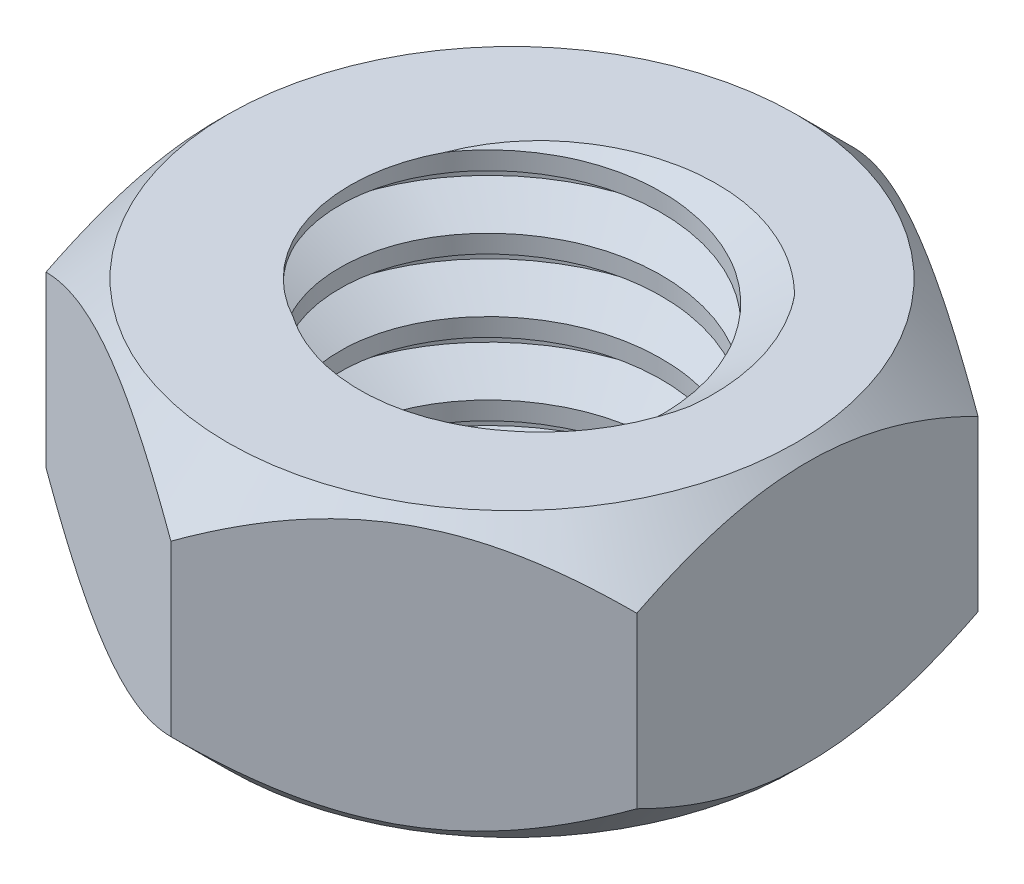
from build123d import *

# Parameters (mm, degrees)
SKETCH1_R           = 3
SKETCH1_R_2         = 1.4224
BOSS_EXTRUDE1_DEPTH = 2.4892
CHAMFER1_SIZE       = 0.5
SKETCH2_R           = 4
CUT_EXTRUDE1_DEPTH  = 5.918954832
THREAD3_PITCH       = 0.635


with BuildPart() as part:
    # Sketch1 → Boss-Extrude1 (new body)
    with BuildSketch(Plane(origin=(0, 0, 0), x_dir=(1, 0, 0), z_dir=(0, 1, 0))):
        with Locations(Location((0, 0, 0), (0, 0, 270))):
            Circle(SKETCH1_R)
        with Locations(Location((0, 0, 0), (0, 0, 270))):
            Circle(SKETCH1_R_2, mode=Mode.SUBTRACT)
    extrude(amount=BOSS_EXTRUDE1_DEPTH)

    # Chamfer1
    chamfer1_edges = [part.edges().sort_by_distance(p)[0] for p in [
        (0, 0, -3),
        (0, 2.4892, -3),
    ]]
    chamfer(chamfer1_edges, length=CHAMFER1_SIZE)

    # Sketch2 → Cut-Extrude1 (cut, through all)
    with BuildSketch(Plane(origin=(0, 2.4892, 0), x_dir=(1, 0, 0), z_dir=(0, 1, 0))):
        Circle(SKETCH2_R)
        Polygon((0, 3), (-2.598076211, 1.5), (-2.598076211, -1.5), (0, -3), (2.598076211, -1.5), (2.598076211, 1.5), align=None, mode=Mode.SUBTRACT)
    extrude(amount=-CUT_EXTRUDE1_DEPTH, mode=Mode.SUBTRACT)

    # Thread3: the profile of Thread Profile3 profile screwed along a right-hand helix of 15.748031 turns, 6 arcs to a turn; built about Z, then put on its axis
    thread3_z = Axis((0, 0, 0), (0, 0, 1))
    thread3_corners = [(1.4221, 0, -0.000173205), (1.766103831, 0, 0.198437499), (1.766103831, 0, 0.277812499), (1.4221, 0, 0.476423203)]
    with BuildLine(mode=Mode.PRIVATE) as thread3_profile:
        Line(thread3_corners[0], thread3_corners[1])
        Line(thread3_corners[1], thread3_corners[2])
        Line(thread3_corners[2], thread3_corners[3])
        Line(thread3_corners[3], thread3_corners[0])
    thread3_cap = Face(thread3_profile.wire())
    thread3_turn_angles = [0, 30, 60, 90, 120, 150, 180, 210, 240, 270, 300, 330, 360]
    thread3_turn_weights = [1, 0.8660254037844387, 1, 0.8660254037844387, 1, 0.8660254037844387, 1, 0.8660254037844387, 1, 0.8660254037844387, 1, 0.8660254037844387, 1]
    thread3_turn_rails = [Edge.make_bspline([Vector(p[0], p[1], 0).rotate(thread3_z, thread3_turn_angles[k]) / thread3_turn_weights[k] + Vector(0, 0, p[2] + THREAD3_PITCH * thread3_turn_angles[k] / 360) for k in range(13)], [0, 0, 0, 1, 1, 2, 2, 3, 3, 4, 4, 5, 5, 6, 6, 6], 2, thread3_turn_weights) for p in thread3_corners]
    thread3_turn_sides = [Face.make_surface_from_curves(thread3_turn_rails[p[0]], thread3_turn_rails[p[1]]) for p in [(0, 1), (1, 2), (2, 3), (3, 0)]]
    thread3_last_angles = [5400, 5430, 5460, 5490, 5520, 5550, 5580, 5610, 5640, 5654.645669291, 5669.291338583]
    thread3_last_weights = [1, 0.8660254037844387, 1, 0.8660254037844387, 1, 0.8660254037844387, 1, 0.8660254037844387, 1, 0.9675079437748935, 1]
    thread3_last_rails = [Edge.make_bspline([Vector(p[0], p[1], 0).rotate(thread3_z, thread3_last_angles[k]) / thread3_last_weights[k] + Vector(0, 0, p[2] + THREAD3_PITCH * thread3_last_angles[k] / 360) for k in range(11)], [0, 0, 0, 1, 1, 2, 2, 3, 3, 4, 4, 5, 5, 5], 2, thread3_last_weights) for p in thread3_corners]
    thread3_last_sides = [Face.make_surface_from_curves(thread3_last_rails[p[0]], thread3_last_rails[p[1]]) for p in [(0, 1), (1, 2), (2, 3), (3, 0)]]
    thread3 = Plane(origin=(0, 10, 0), x_dir=(-1, 0, 0), z_dir=(0, -1, 0)) * Solid(Shell([*[p.moved(Location((0, 0, THREAD3_PITCH * i))) for i in range(15) for p in thread3_turn_sides], *thread3_last_sides, thread3_cap, thread3_cap.rotate(thread3_z, 5669.291338583).moved(Location((0, 0, THREAD3_PITCH * 5669.291338583 / 360)))]))
    add(thread3, mode=Mode.SUBTRACT)


solid = part.part
